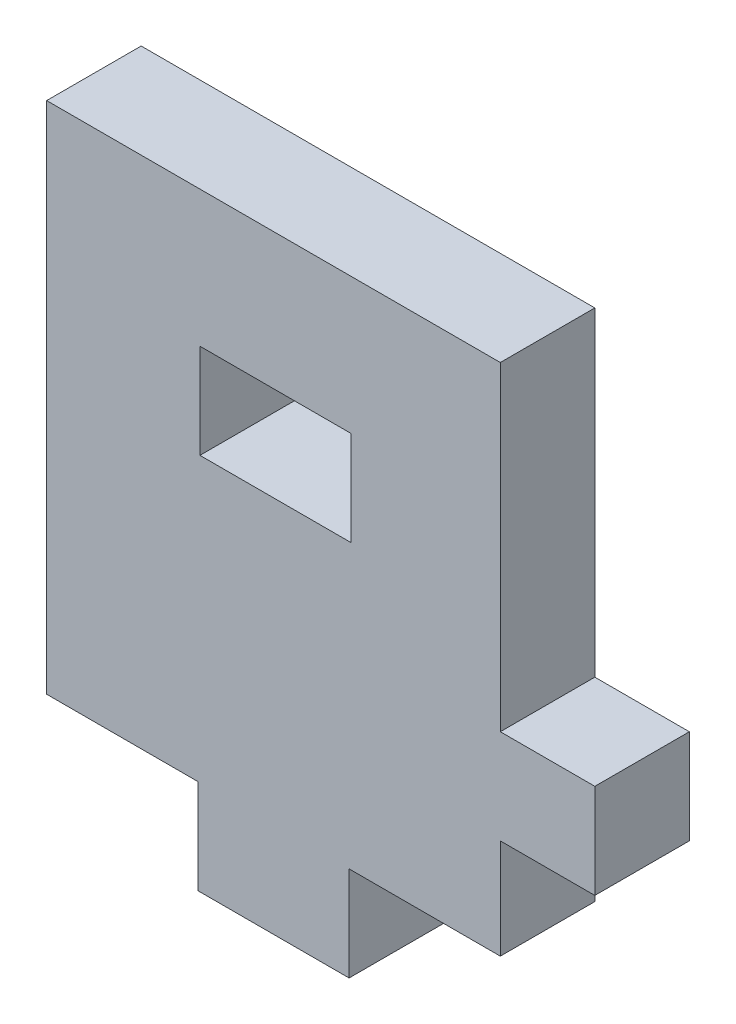
from build123d import *

# Parameters (mm, degrees)
SKETCH1_W           = 30.48
SKETCH1_H           = 34.544
BOSS_EXTRUDE1_DEPTH = 3.175
SKETCH2_W           = 6.35
SKETCH2_H           = 6.35
BOSS_EXTRUDE2_DEPTH = 6.35
SKETCH5_W           = 10.16
SKETCH5_H           = 6.35
BOSS_EXTRUDE4_DEPTH = 6.35
CAVITY1_START       = 1.778
CAVITY1_OUTLINE_W   = 10.16
CAVITY1_OUTLINE_H   = 6.35
CAVITY1_DEPTH       = 6.35


# Read off the part's stored shape, not the designer's step: Cavity1
with BuildPart() as part:
    # Sketch1 → Boss-Extrude1 (new, symmetric)
    with BuildSketch(Plane.XY):
        Rectangle(SKETCH1_W, SKETCH1_H)
    extrude(amount=BOSS_EXTRUDE1_DEPTH, both=True)

    # Sketch2 → Boss-Extrude2 (add)
    with BuildSketch(Plane.XY.offset(3.175)):
        with Locations((18.415, -7.387912323)):
            Rectangle(SKETCH2_W, SKETCH2_H)
    extrude(amount=-BOSS_EXTRUDE2_DEPTH)

    # Sketch5 → Boss-Extrude4 (add)
    with BuildSketch(Plane.XY.offset(3.175)):
        with Locations((0, -20.447)):
            Rectangle(SKETCH5_W, SKETCH5_H)
    extrude(amount=-BOSS_EXTRUDE4_DEPTH)

    # Cavity1 outline → Cavity1 (cut)
    with BuildSketch(Plane(origin=(0, 0, 0), x_dir=(1, 0, 0), z_dir=(0, 1, 0)).offset(CAVITY1_START)):
        with Locations((0.138449205, 0)):
            Rectangle(CAVITY1_OUTLINE_W, CAVITY1_OUTLINE_H)
    extrude(amount=CAVITY1_DEPTH, mode=Mode.SUBTRACT)


solid = part.part
